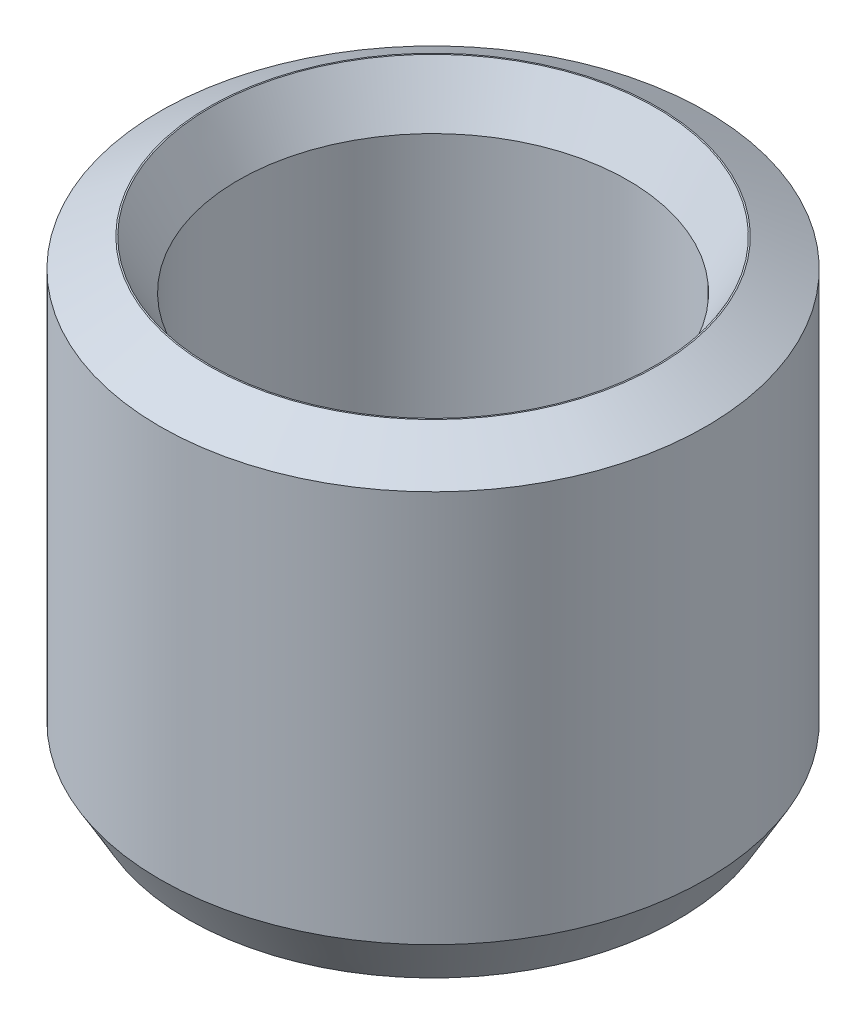
from build123d import *
from OCP.BRepFilletAPI import BRepFilletAPI_MakeChamfer

# Parameters (mm, degrees)
SKETCH1_R           = 10
BOSS_EXTRUDE1_DEPTH = 17.178392628
SKETCH2_R           = 7.135560895
CUT_EXTRUDE1_DEPTH  = 23.250779161
CHAMFER1_SIZE       = 1.030123258
CHAMFER1_SIZE2      = 1.784225821


with BuildPart() as part:
    # Sketch1 → Boss-Extrude1 (new body)
    with BuildSketch(Plane(origin=(0, 0, 0), x_dir=(1, 0, 0), z_dir=(0, 1, 0))):
        Circle(SKETCH1_R)
    extrude(amount=BOSS_EXTRUDE1_DEPTH)

    # Sketch2 → Cut-Extrude1 (cut, through all)
    with BuildSketch(Plane(origin=(0, 0, 0), x_dir=(1, 0, 0), z_dir=(0, 1, 0))):
        Circle(SKETCH2_R)
    extrude(amount=CUT_EXTRUDE1_DEPTH, mode=Mode.SUBTRACT)

    # Chamfer1: one chamfer whose edges measure the first distance from different faces: ONE call of the kernel's chamfer builder (chamfer() names one face for all edges)
    chamfer1_edges_1 = [part.edges().sort_by_distance(p)[0] for p in [
        (-7.135560895, 17.178392628, 0),
    ]]
    chamfer1_side_1 = [part.faces().sort_by_distance(p)[0] for p in [
        (-9.717157288, 17.178392628, 0),
    ]]
    chamfer1_edges_2 = [part.edges().sort_by_distance(p)[0] for p in [
        (-7.135560895, 0, 0),
    ]]
    chamfer1_side_2 = [part.faces().sort_by_distance(p)[0] for p in [
        (-7.135560895, 8.589196314, 0),
    ]]
    chamfer1_edges_3 = [part.edges().sort_by_distance(p)[0] for p in [
        (-10, 0, 0),
    ]]
    chamfer1_side_3 = [part.faces().sort_by_distance(p)[0] for p in [
        (-9.717157288, 0, 0),
    ]]
    chamfer1_edges_4 = [part.edges().sort_by_distance(p)[0] for p in [
        (-10, 17.178392628, 0),
    ]]
    chamfer1_side_4 = [part.faces().sort_by_distance(p)[0] for p in [
        (-10, 8.589196314, 0),
    ]]
    chamfer1 = BRepFilletAPI_MakeChamfer(part.part.solid().wrapped)
    for e in chamfer1_edges_1:
        chamfer1.Add(CHAMFER1_SIZE, CHAMFER1_SIZE2, e.wrapped, chamfer1_side_1[0].wrapped)  # the first distance lies on this face
    for e in chamfer1_edges_2:
        chamfer1.Add(CHAMFER1_SIZE, CHAMFER1_SIZE2, e.wrapped, chamfer1_side_2[0].wrapped)  # the first distance lies on this face
    for e in chamfer1_edges_3:
        chamfer1.Add(CHAMFER1_SIZE, CHAMFER1_SIZE2, e.wrapped, chamfer1_side_3[0].wrapped)  # the first distance lies on this face
    for e in chamfer1_edges_4:
        chamfer1.Add(CHAMFER1_SIZE, CHAMFER1_SIZE2, e.wrapped, chamfer1_side_4[0].wrapped)  # the first distance lies on this face
    add(Compound.cast(chamfer1.Shape()), mode=Mode.REPLACE)


solid = part.part
